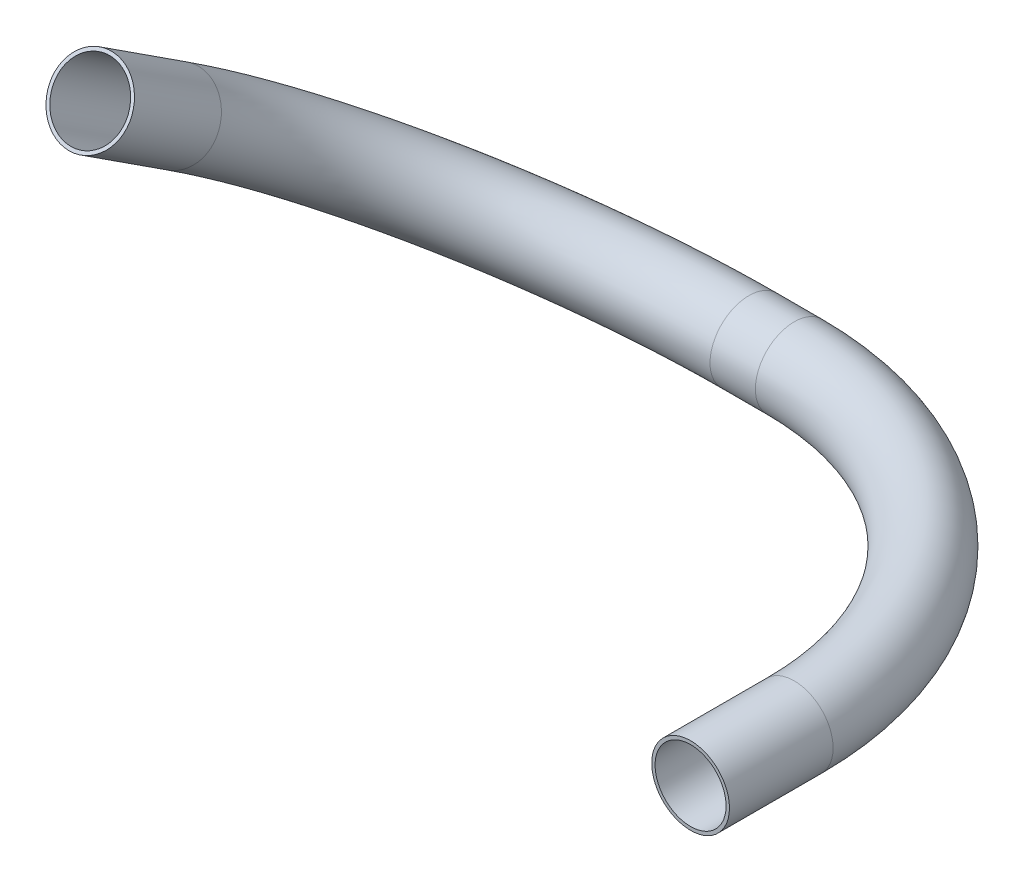
from build123d import *

# Parameters (mm, degrees)
SKETCH5_R            = 19.05
SKETCH5_R_2          = 17.399
SWEEP2_START         = -50.8000001
SWEEP2_OUTLINE_R     = 19.05
SWEEP2_OUTLINE_R_2   = 17.399
SWEEP2_DEPTH         = 50.8000001
SWEEP2_2_OUTLINE_R   = 19.05
SWEEP2_2_OUTLINE_R_2 = 17.399
SWEEP2_2_ANGLE       = 90


with BuildPart() as part:
    # Sweep1: sweep along a path in Sketch4
    with BuildLine(Plane(origin=(0, 92.816218496, -60.275557063), x_dir=(1, 0, 0), z_dir=(0, 0.8386705679454234, -0.5446390350150281))) as sweep1_path:
        Line((174.625, 170.417859407), (152.4, 170.417859407))
        ThreePointArc((152.4, 170.417859407), (44.636926547, 125.780932859), (0, 18.017859407))
        Line((0, 18.017859407), (0, -32.782140593))
    # Sketch5 → Sweep1 (sweep)
    with BuildSketch(Plane(origin=(327.025, 110.670651915, -32.782140593), x_dir=(1, 0, 0), z_dir=(0, 0.5446390350150281, 0.8386705679454234))):
        with Locations((-327.025, 0)):
            Circle(SKETCH5_R)
        with Locations((-327.025, 0)):
            Circle(SKETCH5_R_2, mode=Mode.SUBTRACT)
    sweep(path=sweep1_path.line)



with BuildPart() as body_2:
    # Sweep2: read off the stored shape, not the designer's step
    # Sweep2 outline → Sweep2 (new body)
    with BuildSketch(Plane.XY.offset(SWEEP2_START)):
        with Locations((327.025, 0)):
            Circle(SWEEP2_OUTLINE_R)
        with Locations((327.025, 0)):
            Circle(SWEEP2_OUTLINE_R_2, mode=Mode.SUBTRACT)
    extrude(amount=SWEEP2_DEPTH)


with BuildPart() as part_1:
    add(part.part)

    add(body_2.part)  # Sweep2 2 merges body 2
    # Sweep2 2 outline → Sweep2 2 (revolve)
    with BuildSketch(Plane(origin=(174.625, 0, -50.8), x_dir=(1, 0, 0), z_dir=(0, 0, 1))):
        with Locations((152.4, 0)):
            Circle(SWEEP2_2_OUTLINE_R)
        with Locations((152.4, 0)):
            Circle(SWEEP2_2_OUTLINE_R_2, mode=Mode.SUBTRACT)
    revolve(axis=Axis((174.625, 0, -50.8), (0, 1, 0)), revolution_arc=SWEEP2_2_ANGLE)


solid = part_1.part
